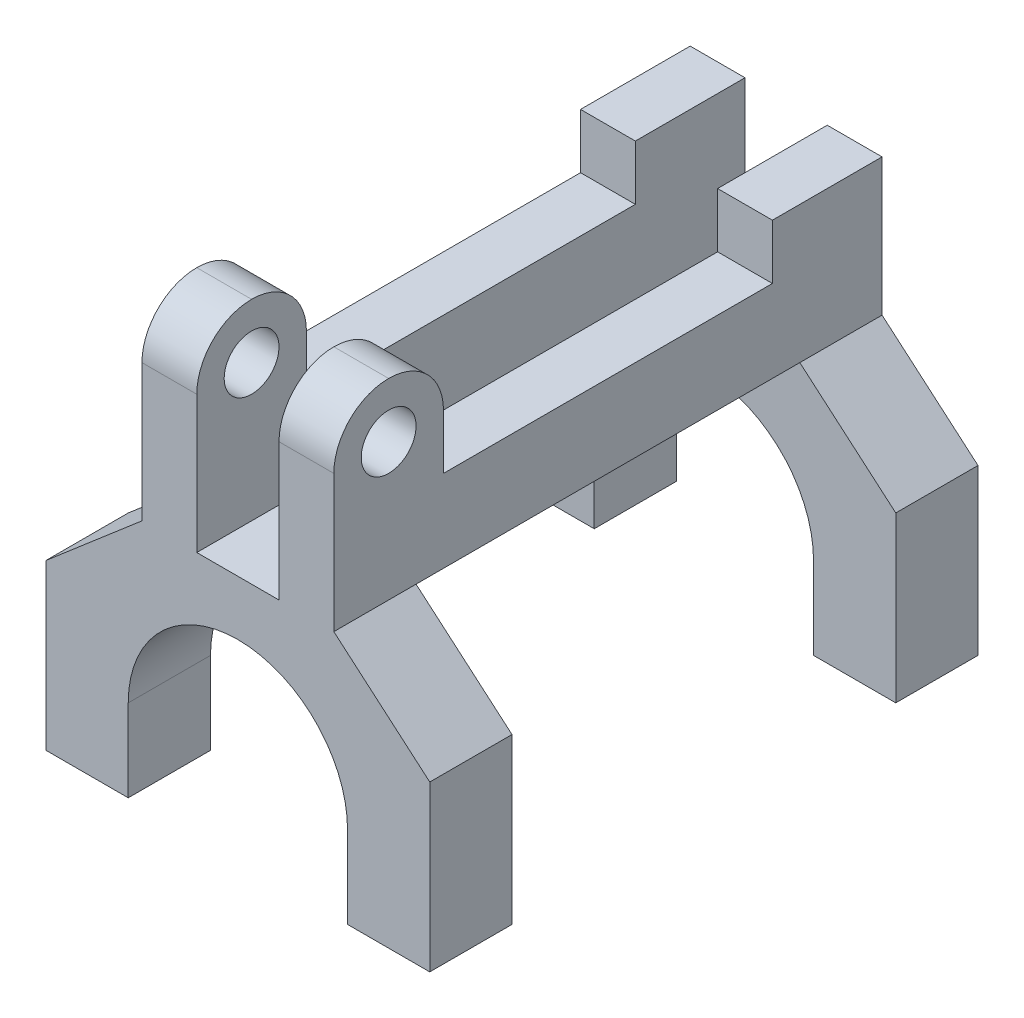
from build123d import *

# Parameters (mm, degrees)
BOSS_EXTRUDE1_DEPTH = 127
SKETCH3_W           = 88.9
SKETCH3_H           = 57.15
CUT_EXTRUDE1_DEPTH  = 166.222070257
SKETCH5_W           = 44.45
SKETCH5_H           = 44.45
BOSS_EXTRUDE2_DEPTH = 127
CUT_EXTRUDE2_DEPTH  = 176.775753803
FILLET1_R           = 12.7
SKETCH8_R           = 6.35
CUT_EXTRUDE3_DEPTH  = 176.775753803
SKETCH9_W           = 19.05
SKETCH9_H           = 44.45
CUT_EXTRUDE4_DEPTH  = 186.350397895


with BuildPart() as part:
    # Sketch2 → Boss-Extrude1 (new body)
    with BuildSketch(Plane.XY):
        with BuildLine():
            Line((0, 0), (19.05, 0))
            Line((19.05, 0), (19.05, 19.05))
            ThreePointArc((19.05, 19.05), (44.45, 44.45), (69.85, 19.05))
            Line((69.85, 19.05), (69.85, 0))
            Line((69.85, 0), (88.9, 0))
            Line((88.9, 0), (88.9, 38.1))
            Line((88.9, 38.1), (66.675, 57.15))
            Line((66.675, 57.15), (22.225, 57.15))
            Line((22.225, 57.15), (0, 38.1))
            Line((0, 38.1), (0, 0))
        make_face()
    extrude(amount=-BOSS_EXTRUDE1_DEPTH)

    # Sketch3 → Cut-Extrude1 (cut, through all)
    with BuildSketch(Plane(origin=(88.9, 0, 0), x_dir=(0, 0, -1), z_dir=(1, 0, 0))):
        with Locations((63.5, 28.575)):
            Rectangle(SKETCH3_W, SKETCH3_H)
    extrude(amount=-CUT_EXTRUDE1_DEPTH, mode=Mode.SUBTRACT)


with BuildPart() as cut_extrude1_piece_1:
    # of the separate pieces the step leaves, piece 1, a body of its own (cut_extrude1_pieces)
    add(part.part.solids().sort_by_distance((0, 0, 0))[0])



with BuildPart() as cut_extrude1_piece_2:
    # of the separate pieces the step leaves, piece 2, a body of its own (cut_extrude1_pieces)
    add(part.part.solids().sort_by_distance((19.05, 0, -107.95))[0])


with BuildPart() as cut_extrude1_piece_1_1:
    add(cut_extrude1_piece_1.part)

    add(cut_extrude1_piece_2.part)  # Boss-Extrude2 merges Cut-Extrude1 piece 2
    # Sketch5 → Boss-Extrude2 (add)
    with BuildSketch(Plane.XY):
        with Locations((44.45, 79.375)):
            Rectangle(SKETCH5_W, SKETCH5_H)
    extrude(amount=-BOSS_EXTRUDE2_DEPTH)

    # Sketch6 → Cut-Extrude2 (cut, through all)
    with BuildSketch(Plane(origin=(66.675, 0, 0), x_dir=(0, 0, -1), z_dir=(1, 0, 0))):
        Polygon((127, 88.9), (101.6, 88.9), (101.6, 76.2), (25.4, 76.2), (25.4, 101.6), (127, 101.6), align=None)
    extrude(amount=-CUT_EXTRUDE2_DEPTH, mode=Mode.SUBTRACT)

    # Fillet1
    fillet1_edges = [cut_extrude1_piece_1_1.edges().sort_by_distance(p)[0] for p in [
        (44.45, 101.6, -25.4),
        (44.45, 101.6, 0),
    ]]
    fillet(fillet1_edges, radius=FILLET1_R - 0.0001)  # a hair under: the kernel refuses the full size

    # Sketch8 → Cut-Extrude3 (cut, through all)
    with BuildSketch(Plane(origin=(66.675, 0, 0), x_dir=(0, 0, -1), z_dir=(1, 0, 0))):
        with Locations((12.7, 88.9)):
            Circle(SKETCH8_R)
    extrude(amount=-CUT_EXTRUDE3_DEPTH, mode=Mode.SUBTRACT)

    # Sketch9 → Cut-Extrude4 (cut, through all)
    with BuildSketch(Plane.XY):
        with Locations((44.45, 79.375)):
            Rectangle(SKETCH9_W, SKETCH9_H)
    extrude(amount=-CUT_EXTRUDE4_DEPTH, mode=Mode.SUBTRACT)


solid = cut_extrude1_piece_1_1.part
